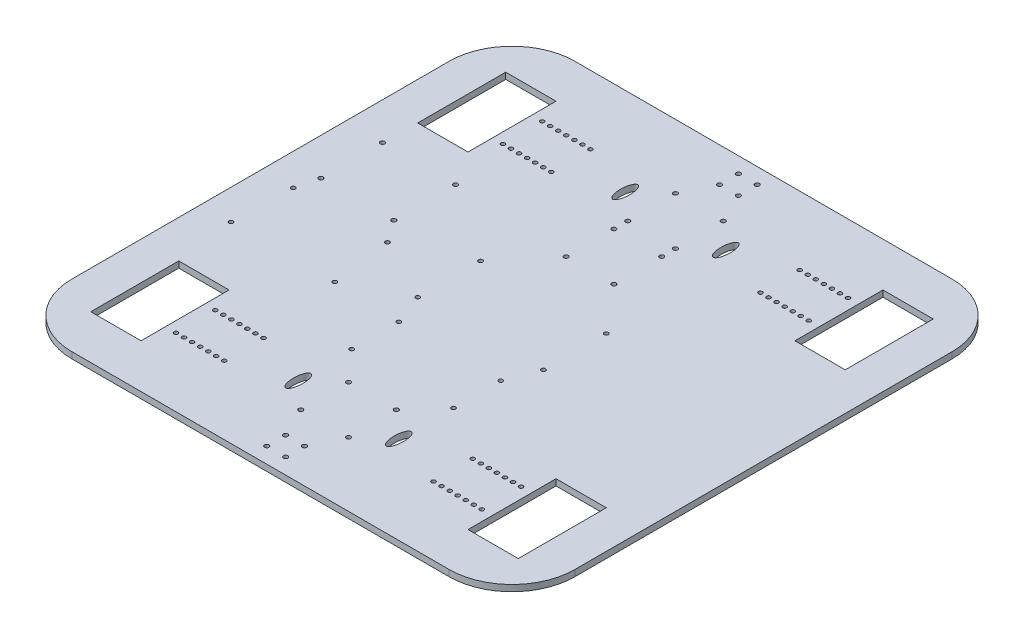
from build123d import *

# Parameters (mm, degrees)
SKETCH1_W           = 400
SKETCH1_H           = 400
SKETCH1_R           = 1.75
SKETCH1_W_2         = 40
SKETCH1_H_2         = 70
BOSS_EXTRUDE2_DEPTH = 5
FILLET1_R           = 50
SKETCH2_R           = 1.6
CUT_EXTRUDE1_DEPTH  = 5
SKETCH3_R           = 1.65
CUT_EXTRUDE2_DEPTH  = 10
SKETCH4_R           = 1.75
CUT_EXTRUDE3_DEPTH  = 10
SKETCH5_R           = 1.75
CUT_EXTRUDE4_DEPTH  = 10
SKETCH6_RX          = 10
SKETCH6_RY          = 3.75
CUT_EXTRUDE5_DEPTH  = 10
SKETCH7_R           = 1.65
CUT_EXTRUDE6_DEPTH  = 10
SKETCH8_R           = 1.65
CUT_EXTRUDE7_DEPTH  = 5


with BuildPart() as part:
    # Sketch1 → Boss-Extrude2 (new body)
    with BuildSketch(Plane(origin=(0, 0, 0), x_dir=(1, 0, 0), z_dir=(0, 1, 0))):
        Rectangle(SKETCH1_W, SKETCH1_H)
        with Locations((-7.5, 172.5)):
            Circle(SKETCH1_R, mode=Mode.SUBTRACT)
        with Locations((-7.5, 187.5)):
            Circle(SKETCH1_R, mode=Mode.SUBTRACT)
        with Locations((7.5, 172.5)):
            Circle(SKETCH1_R, mode=Mode.SUBTRACT)
        with Locations((7.5, 187.5)):
            Circle(SKETCH1_R, mode=Mode.SUBTRACT)
        with Locations((-150, -130)):
            Rectangle(SKETCH1_W_2, SKETCH1_H_2, mode=Mode.SUBTRACT)
        with Locations((150, -130)):
            Rectangle(SKETCH1_W_2, SKETCH1_H_2, mode=Mode.SUBTRACT)
        with Locations((-150, 130)):
            Rectangle(SKETCH1_W_2, SKETCH1_H_2, mode=Mode.SUBTRACT)
        with Locations((150, 130)):
            Rectangle(SKETCH1_W_2, SKETCH1_H_2, mode=Mode.SUBTRACT)
        with Locations((-7.5, -187.5)):
            Circle(SKETCH1_R, mode=Mode.SUBTRACT)
        with Locations((-7.5, -172.5)):
            Circle(SKETCH1_R, mode=Mode.SUBTRACT)
        with Locations((7.5, -187.5)):
            Circle(SKETCH1_R, mode=Mode.SUBTRACT)
        with Locations((7.5, -172.5)):
            Circle(SKETCH1_R, mode=Mode.SUBTRACT)
    extrude(amount=BOSS_EXTRUDE2_DEPTH)

    # Fillet1
    fillet1_edges = [part.edges().sort_by_distance(p)[0] for p in [
        (200, 2.5, -200),
        (200, 2.5, 200),
        (-200, 2.5, 200),
        (-200, 2.5, -200),
    ]]
    fillet(fillet1_edges, radius=FILLET1_R)

    # Sketch2 → Cut-Extrude1 (cut)
    with BuildSketch(Plane(origin=(0, 5, 0), x_dir=(1, 0, 0), z_dir=(0, 1, 0))):
        with Locations((-121.6, 145.6)):
            Circle(SKETCH2_R)
        with Locations((-115.2, 145.6)):
            Circle(SKETCH2_R)
        with Locations((-108.8, 145.6)):
            Circle(SKETCH2_R)
        with Locations((-102.4, 145.6)):
            Circle(SKETCH2_R)
        with Locations((-96, 145.6)):
            Circle(SKETCH2_R)
        with Locations((-89.6, 145.6)):
            Circle(SKETCH2_R)
        with Locations((-83.2, 145.6)):
            Circle(SKETCH2_R)
        with Locations((-83.2, 114.4)):
            Circle(SKETCH2_R)
        with Locations((-89.6, 114.4)):
            Circle(SKETCH2_R)
        with Locations((-96, 114.4)):
            Circle(SKETCH2_R)
        with Locations((-102.4, 114.4)):
            Circle(SKETCH2_R)
        with Locations((-108.8, 114.4)):
            Circle(SKETCH2_R)
        with Locations((-115.2, 114.4)):
            Circle(SKETCH2_R)
        with Locations((-121.6, 114.4)):
            Circle(SKETCH2_R)
        with Locations((83.2, 114.4)):
            Circle(SKETCH2_R)
        with Locations((89.6, 114.4)):
            Circle(SKETCH2_R)
        with Locations((96, 114.4)):
            Circle(SKETCH2_R)
        with Locations((102.4, 114.4)):
            Circle(SKETCH2_R)
        with Locations((108.8, 114.4)):
            Circle(SKETCH2_R)
        with Locations((115.2, 114.4)):
            Circle(SKETCH2_R)
        with Locations((121.6, 114.4)):
            Circle(SKETCH2_R)
        with Locations((83.2, 145.6)):
            Circle(SKETCH2_R)
        with Locations((89.6, 145.6)):
            Circle(SKETCH2_R)
        with Locations((96, 145.6)):
            Circle(SKETCH2_R)
        with Locations((102.4, 145.6)):
            Circle(SKETCH2_R)
        with Locations((108.8, 145.6)):
            Circle(SKETCH2_R)
        with Locations((115.2, 145.6)):
            Circle(SKETCH2_R)
        with Locations((121.6, 145.6)):
            Circle(SKETCH2_R)
        with Locations((121.6, -145.6)):
            Circle(SKETCH2_R)
        with Locations((115.2, -145.6)):
            Circle(SKETCH2_R)
        with Locations((108.8, -145.6)):
            Circle(SKETCH2_R)
        with Locations((102.4, -145.6)):
            Circle(SKETCH2_R)
        with Locations((96, -145.6)):
            Circle(SKETCH2_R)
        with Locations((89.6, -145.6)):
            Circle(SKETCH2_R)
        with Locations((83.2, -145.6)):
            Circle(SKETCH2_R)
        with Locations((121.6, -114.4)):
            Circle(SKETCH2_R)
        with Locations((115.2, -114.4)):
            Circle(SKETCH2_R)
        with Locations((108.8, -114.4)):
            Circle(SKETCH2_R)
        with Locations((102.4, -114.4)):
            Circle(SKETCH2_R)
        with Locations((96, -114.4)):
            Circle(SKETCH2_R)
        with Locations((89.6, -114.4)):
            Circle(SKETCH2_R)
        with Locations((83.2, -114.4)):
            Circle(SKETCH2_R)
        with Locations((-121.6, -114.4)):
            Circle(SKETCH2_R)
        with Locations((-115.2, -114.4)):
            Circle(SKETCH2_R)
        with Locations((-108.8, -114.4)):
            Circle(SKETCH2_R)
        with Locations((-102.4, -114.4)):
            Circle(SKETCH2_R)
        with Locations((-96, -114.4)):
            Circle(SKETCH2_R)
        with Locations((-89.6, -114.4)):
            Circle(SKETCH2_R)
        with Locations((-83.2, -114.4)):
            Circle(SKETCH2_R)
        with Locations((-83.2, -145.6)):
            Circle(SKETCH2_R)
        with Locations((-89.6, -145.6)):
            Circle(SKETCH2_R)
        with Locations((-96, -145.6)):
            Circle(SKETCH2_R)
        with Locations((-102.4, -145.6)):
            Circle(SKETCH2_R)
        with Locations((-108.8, -145.6)):
            Circle(SKETCH2_R)
        with Locations((-115.2, -145.6)):
            Circle(SKETCH2_R)
        with Locations((-121.6, -145.6)):
            Circle(SKETCH2_R)
    extrude(amount=-CUT_EXTRUDE1_DEPTH, mode=Mode.SUBTRACT)

    # Sketch3 → Cut-Extrude2 (cut)
    with BuildSketch(Plane(origin=(0, 5, 0), x_dir=(1, 0, 0), z_dir=(0, 1, 0))):
        with Locations((-176.03, -47.46)):
            Circle(SKETCH3_R)
        with Locations((-174.76, 0.8)):
            Circle(SKETCH3_R)
        with Locations((-93.48, -47.46)):
            Circle(SKETCH3_R)
        with Locations((-99.83, 0.8)):
            Circle(SKETCH3_R)
    extrude(amount=-CUT_EXTRUDE2_DEPTH, mode=Mode.SUBTRACT)

    # Sketch4 → Cut-Extrude3 (cut)
    with BuildSketch(Plane(origin=(0, 5, 0), x_dir=(1, 0, 0), z_dir=(0, 1, 0))):
        with Locations((-19, 149)):
            Circle(SKETCH4_R)
        with Locations((19, 149)):
            Circle(SKETCH4_R)
        with Locations((19, 111)):
            Circle(SKETCH4_R)
        with Locations((-19, 111)):
            Circle(SKETCH4_R)
        with Locations((-19, 100)):
            Circle(SKETCH4_R)
        with Locations((19, 100)):
            Circle(SKETCH4_R)
        with Locations((19, 62)):
            Circle(SKETCH4_R)
        with Locations((-19, 62)):
            Circle(SKETCH4_R)
        with Locations((-19, -149)):
            Circle(SKETCH4_R)
        with Locations((19, -149)):
            Circle(SKETCH4_R)
        with Locations((-19, -111)):
            Circle(SKETCH4_R)
        with Locations((19, -111)):
            Circle(SKETCH4_R)
    extrude(amount=-CUT_EXTRUDE3_DEPTH, mode=Mode.SUBTRACT)

    # Sketch5 → Cut-Extrude4 (cut)
    with BuildSketch(Plane(origin=(0, 5, 0), x_dir=(1, 0, 0), z_dir=(0, 1, 0))):
        with Locations((-170.5, 67.5)):
            Circle(SKETCH5_R)
        with Locations((-112.5, 67.5)):
            Circle(SKETCH5_R)
        with Locations((-112.5, 18.5)):
            Circle(SKETCH5_R)
        with Locations((-170.5, 18.5)):
            Circle(SKETCH5_R)
    extrude(amount=-CUT_EXTRUDE4_DEPTH, mode=Mode.SUBTRACT)

    # Sketch6 → Cut-Extrude5 (cut)
    with BuildSketch(Plane(origin=(0, 5, 0), x_dir=(1, 0, 0), z_dir=(0, 1, 0))):
        with Locations(Location((-40, 130), (0, 0, 90))):
            Ellipse(SKETCH6_RX, SKETCH6_RY)
        with Locations(Location((40, 130), (0, 0, 90))):
            Ellipse(SKETCH6_RX, SKETCH6_RY)
        with Locations(Location((40, -130), (0, 0, -90))):
            Ellipse(SKETCH6_RX, SKETCH6_RY)
        with Locations(Location((-40, -130), (0, 0, -90))):
            Ellipse(SKETCH6_RX, SKETCH6_RY)
    extrude(amount=-CUT_EXTRUDE5_DEPTH, mode=Mode.SUBTRACT)

    # Sketch7 → Cut-Extrude6 (cut)
    with BuildSketch(Plane(origin=(0, 5, 0), x_dir=(1, 0, 0), z_dir=(0, 1, 0))):
        with Locations((-50, 25)):
            Circle(SKETCH7_R)
        with Locations((50, 25)):
            Circle(SKETCH7_R)
        with Locations((50, -25)):
            Circle(SKETCH7_R)
        with Locations((-50, -25)):
            Circle(SKETCH7_R)
    extrude(amount=-CUT_EXTRUDE6_DEPTH, mode=Mode.SUBTRACT)

    # Sketch8 → Cut-Extrude7 (cut)
    with BuildSketch(Plane(origin=(0, 5, 0), x_dir=(1, 0, 0), z_dir=(0, 1, 0))):
        with Locations((-40.5, -49.5)):
            Circle(SKETCH8_R)
        with Locations((40.5, -49.5)):
            Circle(SKETCH8_R)
        with Locations((40.5, -87)):
            Circle(SKETCH8_R)
        with Locations((-40.5, -87)):
            Circle(SKETCH8_R)
    extrude(amount=-CUT_EXTRUDE7_DEPTH, mode=Mode.SUBTRACT)


solid = part.part
